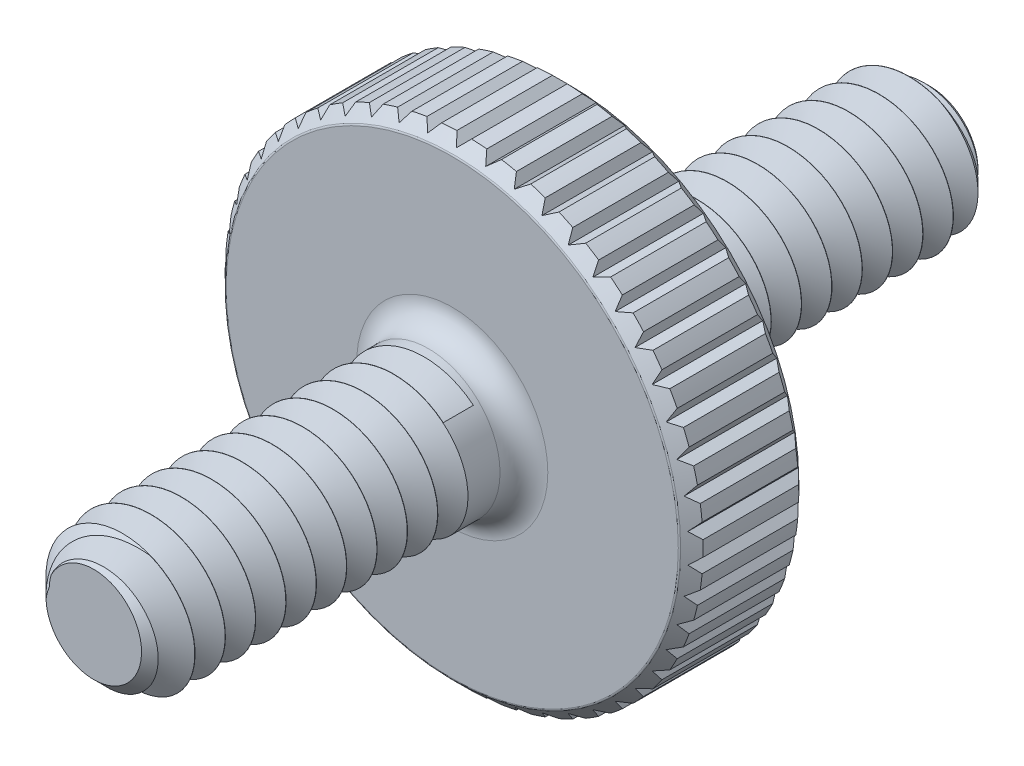
from build123d import *

# Parameters (mm, degrees)
SKETCH_1_R          = 10
EXTRUDE_1_DEPTH     = 5
SKETCH_2_R          = 3
EXTRUDE_2_DEPTH     = 15
EXTRUDE_START       = 15
SKETCH_3_R          = 3
EXTRUDE_3_DEPTH     = 15
CHAMFER_1_SIZE      = 1
CHAMFER_2_SIZE      = 0.5
FILLET_3_R          = 1
SWEEP_1_PITCH       = 1.27
SWEEP_3_PITCH       = 1.27
CUT_EXTRUDE_1_DEPTH = 25.494897509
FILLET_1_R          = 0.1


with BuildPart() as part:
    # Эскиз1 → Бобышка-Вытянуть1 (new body)
    with BuildSketch(Plane.XY):
        Circle(SKETCH_1_R)
    extrude(amount=EXTRUDE_1_DEPTH)

    # Эскиз2 → Бобышка-Вытянуть2 (add)
    with BuildSketch(Plane.XY.offset(5)):
        Circle(SKETCH_2_R)
    extrude(amount=EXTRUDE_2_DEPTH)

    # Эскиз3 → Бобышка-Вытянуть3 (add)
    with BuildSketch(Plane(origin=(0, 0, 0), x_dir=(-1, 0, 0), z_dir=(0, 0, -1)).offset(EXTRUDE_START)):
        with Locations(Location((0, 0, 0), (0, 0, 180))):
            Circle(SKETCH_3_R)
    extrude(amount=-EXTRUDE_3_DEPTH)

    # Фаска1
    chamfer_1_edges = [part.edges().sort_by_distance(p)[0] for p in [
        (-3, 0, -15),
        (-3, 0, 20),
    ]]
    chamfer(chamfer_1_edges, length=CHAMFER_1_SIZE)

    # Фаска2
    chamfer_2_edges = [part.edges().sort_by_distance(p)[0] for p in [
        (-10, 0, 0),
        (-10, 0, 5),
    ]]
    chamfer(chamfer_2_edges, length=CHAMFER_2_SIZE)

    # Скругление3
    fillet_3_edges = [part.edges().sort_by_distance(p)[0] for p in [
        (-3, 0, 5),
        (-3, 0, 0),
    ]]
    fillet(fillet_3_edges, radius=FILLET_3_R)

    # Вырез-По траектории1: arcs per turn and ends read off the stored shape
    # Вырез-По траектории1: the profile of Эскиз7 profile screwed along a right-hand helix through 18.25 turns, 8 arcs to a turn; built about Z, then put on its axis
    sweep_1_z = Axis((0, 0, 0), (0, 0, 1))
    sweep_1_corners = [(1.908807991, 0, -0.04438132), (3.0003, 0, -0.674554525), (3.0003, 0, 0.585791885)]
    with BuildLine(mode=Mode.PRIVATE) as sweep_1_profile:
        Line(sweep_1_corners[0], sweep_1_corners[1])
        Line(sweep_1_corners[1], sweep_1_corners[2])
        Line(sweep_1_corners[2], sweep_1_corners[0])
    sweep_1_cap = Face(sweep_1_profile.wire())
    sweep_1_turn_angles = [0, 22.5, 45, 67.5, 90, 112.5, 135, 157.5, 180, 202.5, 225, 247.5, 270, 292.5, 315, 337.5, 360]
    sweep_1_turn_weights = [1, 0.9238795325112867, 1, 0.9238795325112867, 1, 0.9238795325112867, 1, 0.9238795325112867, 1, 0.9238795325112867, 1, 0.9238795325112867, 1, 0.9238795325112867, 1, 0.9238795325112867, 1]
    sweep_1_turn_rails = [Edge.make_bspline([Vector(p[0], p[1], 0).rotate(sweep_1_z, sweep_1_turn_angles[k]) / sweep_1_turn_weights[k] + Vector(0, 0, p[2] + SWEEP_1_PITCH * sweep_1_turn_angles[k] / 360) for k in range(17)], [0, 0, 0, 1, 1, 2, 2, 3, 3, 4, 4, 5, 5, 6, 6, 7, 7, 8, 8, 8], 2, sweep_1_turn_weights) for p in sweep_1_corners]
    sweep_1_turn_sides = [Face.make_surface_from_curves(sweep_1_turn_rails[p[0]], sweep_1_turn_rails[p[1]]) for p in [(0, 1), (1, 2), (2, 0)]]
    sweep_1_last_angles = [6480, 6502.5, 6525, 6547.5, 6570]
    sweep_1_last_weights = [1, 0.9238795325112867, 1, 0.9238795325111805, 1]
    sweep_1_last_rails = [Edge.make_bspline([Vector(p[0], p[1], 0).rotate(sweep_1_z, sweep_1_last_angles[k]) / sweep_1_last_weights[k] + Vector(0, 0, p[2] + SWEEP_1_PITCH * sweep_1_last_angles[k] / 360) for k in range(5)], [0, 0, 0, 1, 1, 2, 2, 2], 2, sweep_1_last_weights) for p in sweep_1_corners]
    sweep_1_last_sides = [Face.make_surface_from_curves(sweep_1_last_rails[p[0]], sweep_1_last_rails[p[1]]) for p in [(0, 1), (1, 2), (2, 0)]]
    sweep_1 = Plane(origin=(0, 0, 30), x_dir=(-0.7071067811865512, 0.7071067811865438, 0), z_dir=(0, 0, -1)) * Solid(Shell([*[p.moved(Location((0, 0, SWEEP_1_PITCH * i))) for i in range(18) for p in sweep_1_turn_sides], *sweep_1_last_sides, sweep_1_cap, sweep_1_cap.rotate(sweep_1_z, 6570).moved(Location((0, 0, SWEEP_1_PITCH * 6570 / 360)))]))
    add(sweep_1, mode=Mode.SUBTRACT)

    # Вырез-По траектории3: arcs per turn and ends read off the stored shape
    # Вырез-По траектории3: the profile of Эскиз13 profile screwed along a right-hand helix through 12 turns, 8 arcs to a turn; built about Z, then put on its axis
    sweep_3_z = Axis((0, 0, 0), (0, 0, 1))
    sweep_3_corners = [(1.908807991, 0, 0.255243081), (3.0003, 0, -0.374930124), (3.0003, 0, 0.885416286)]
    with BuildLine(mode=Mode.PRIVATE) as sweep_3_profile:
        Line(sweep_3_corners[0], sweep_3_corners[1])
        Line(sweep_3_corners[1], sweep_3_corners[2])
        Line(sweep_3_corners[2], sweep_3_corners[0])
    sweep_3_cap = Face(sweep_3_profile.wire())
    sweep_3_turn_angles = [0, 22.5, 45, 67.5, 90, 112.5, 135, 157.5, 180, 202.5, 225, 247.5, 270, 292.5, 315, 337.5, 360]
    sweep_3_turn_weights = [1, 0.9238795325112867, 1, 0.9238795325112867, 1, 0.9238795325112867, 1, 0.9238795325112867, 1, 0.9238795325112867, 1, 0.9238795325112867, 1, 0.9238795325112867, 1, 0.9238795325112867, 1]
    sweep_3_turn_rails = [Edge.make_bspline([Vector(p[0], p[1], 0).rotate(sweep_3_z, sweep_3_turn_angles[k]) / sweep_3_turn_weights[k] + Vector(0, 0, p[2] + SWEEP_3_PITCH * sweep_3_turn_angles[k] / 360) for k in range(17)], [0, 0, 0, 1, 1, 2, 2, 3, 3, 4, 4, 5, 5, 6, 6, 7, 7, 8, 8, 8], 2, sweep_3_turn_weights) for p in sweep_3_corners]
    sweep_3_turn_sides = [Face.make_surface_from_curves(sweep_3_turn_rails[p[0]], sweep_3_turn_rails[p[1]]) for p in [(0, 1), (1, 2), (2, 0)]]
    sweep_3 = Plane(origin=(0, 0, -17.5), x_dir=(0.7071067811865512, 0.7071067811865438, 0), z_dir=(0, 0, 1)) * Solid(Shell([*[p.moved(Location((0, 0, SWEEP_3_PITCH * i))) for i in range(12) for p in sweep_3_turn_sides], sweep_3_cap, sweep_3_cap.rotate(sweep_3_z, 4320).moved(Location((0, 0, SWEEP_3_PITCH * 4320 / 360)))]))
    add(sweep_3, mode=Mode.SUBTRACT)

    # Эскиз10 → Вырез-Вытянуть1 (cut, through all)
    with BuildSketch(Plane.XY.offset(5)):
        Polygon((-0.313605218, 10), (0, 9.686394782), (0.313605218, 10), align=None)
        Polygon((1.21402718, 9.610014666), (1.564464683, 9.881841857), (0.942199989, 9.960452169), align=None)
        Polygon((2.408908425, 9.382078878), (2.790651605, 9.607841165), (2.183146138, 9.763822058), align=None)
        Polygon((3.565799746, 9.006182101), (3.972828284, 9.182319078), (3.389662769, 9.413210639), align=None)
        Polygon((4.666456275, 8.488252453), (5.092351088, 8.611986334), (4.542722394, 8.914147266), align=None)
        Polygon((5.693520001, 7.836457993), (6.131564474, 7.905837422), (5.624140572, 8.274502466), align=None)
        Polygon((6.630793515, 7.061077909), (7.074079425, 7.07500873), (6.616862694, 7.504363819), align=None)
        Polygon((7.463495454, 6.174340408), (7.905031917, 6.132602924), (7.505232939, 6.615876871), align=None)
        Polygon((8.178493612, 5.190229871), (8.611317334, 5.093482307), (8.275241176, 5.623053593), align=None)
        Polygon((8.76451204, 4.124266308), (9.181797132, 3.974034431), (8.914743917, 4.541551401), align=None)
        Polygon((9.212308877, 2.993260602), (9.607474505, 2.791913658), (9.413655821, 3.38842623), align=None)
        Polygon((9.5148221, 1.815049388), (9.881636265, 1.565762739), (9.764108749, 2.181863553), align=None)
        Polygon((9.667280895, 0.608213761), (9.999958719, 0.314918806), (9.96057585, 0.940891585), align=None)
        Polygon((9.667280895, -0.608213761), (9.96057585, -0.940891585), (9.999958719, -0.314918806), align=None)
        Polygon((9.5148221, -1.815049388), (9.764108749, -2.181863553), (9.881636265, -1.565762739), align=None)
        Polygon((9.212308877, -2.993260602), (9.413655821, -3.38842623), (9.607474505, -2.791913658), align=None)
        Polygon((8.76451204, -4.124266308), (8.914743917, -4.541551401), (9.181797132, -3.974034431), align=None)
        Polygon((8.178493612, -5.190229871), (8.275241176, -5.623053593), (8.611317334, -5.093482307), align=None)
        Polygon((7.463495454, -6.174340408), (7.505232939, -6.615876871), (7.905031917, -6.132602924), align=None)
        Polygon((6.630793515, -7.061077909), (6.616862694, -7.504363819), (7.074079425, -7.07500873), align=None)
        Polygon((5.693520001, -7.836457993), (5.624140572, -8.274502466), (6.131564474, -7.905837422), align=None)
        Polygon((4.666456275, -8.488252453), (4.542722394, -8.914147266), (5.092351088, -8.611986334), align=None)
        Polygon((3.565799746, -9.006182101), (3.389662769, -9.413210639), (3.972828284, -9.182319078), align=None)
        Polygon((2.408908425, -9.382078878), (2.183146138, -9.763822058), (2.790651605, -9.607841165), align=None)
        Polygon((1.21402718, -9.610014666), (0.942199989, -9.960452169), (1.564464683, -9.881841857), align=None)
        Polygon((0, -9.686394782), (-0.313605218, -10), (0.313605218, -10), align=None)
        Polygon((-1.21402718, -9.610014666), (-1.564464683, -9.881841857), (-0.942199989, -9.960452169), align=None)
        Polygon((-2.408908425, -9.382078878), (-2.790651605, -9.607841165), (-2.183146138, -9.763822058), align=None)
        Polygon((-3.565799746, -9.006182101), (-3.972828284, -9.182319078), (-3.389662769, -9.413210639), align=None)
        Polygon((-4.666456275, -8.488252453), (-5.092351088, -8.611986334), (-4.542722394, -8.914147266), align=None)
        Polygon((-5.693520001, -7.836457993), (-6.131564474, -7.905837422), (-5.624140572, -8.274502466), align=None)
        Polygon((-6.630793515, -7.061077909), (-7.074079425, -7.07500873), (-6.616862694, -7.504363819), align=None)
        Polygon((-7.463495454, -6.174340408), (-7.905031917, -6.132602924), (-7.505232939, -6.615876871), align=None)
        Polygon((-8.178493612, -5.190229871), (-8.611317334, -5.093482307), (-8.275241176, -5.623053593), align=None)
        Polygon((-8.76451204, -4.124266308), (-9.181797132, -3.974034431), (-8.914743917, -4.541551401), align=None)
        Polygon((-9.212308877, -2.993260602), (-9.607474505, -2.791913658), (-9.413655821, -3.38842623), align=None)
        Polygon((-9.5148221, -1.815049388), (-9.881636265, -1.565762739), (-9.764108749, -2.181863553), align=None)
        Polygon((-9.667280895, -0.608213761), (-9.999958719, -0.314918806), (-9.96057585, -0.940891585), align=None)
        Polygon((-9.667280895, 0.608213761), (-9.96057585, 0.940891585), (-9.999958719, 0.314918806), align=None)
        Polygon((-9.5148221, 1.815049388), (-9.764108749, 2.181863553), (-9.881636265, 1.565762739), align=None)
        Polygon((-9.212308877, 2.993260602), (-9.413655821, 3.38842623), (-9.607474505, 2.791913658), align=None)
        Polygon((-8.76451204, 4.124266308), (-8.914743917, 4.541551401), (-9.181797132, 3.974034431), align=None)
        Polygon((-8.178493612, 5.190229871), (-8.275241176, 5.623053593), (-8.611317334, 5.093482307), align=None)
        Polygon((-7.463495454, 6.174340408), (-7.505232939, 6.615876871), (-7.905031917, 6.132602924), align=None)
        Polygon((-6.630793515, 7.061077909), (-6.616862694, 7.504363819), (-7.074079425, 7.07500873), align=None)
        Polygon((-5.693520001, 7.836457993), (-5.624140572, 8.274502466), (-6.131564474, 7.905837422), align=None)
        Polygon((-4.666456275, 8.488252453), (-4.542722394, 8.914147266), (-5.092351088, 8.611986334), align=None)
        Polygon((-3.565799746, 9.006182101), (-3.389662769, 9.413210639), (-3.972828284, 9.182319078), align=None)
        Polygon((-2.408908425, 9.382078878), (-2.183146138, 9.763822058), (-2.790651605, 9.607841165), align=None)
        Polygon((-1.21402718, 9.610014666), (-0.942199989, 9.960452169), (-1.564464683, 9.881841857), align=None)
    extrude(amount=-CUT_EXTRUDE_1_DEPTH, mode=Mode.SUBTRACT)

    # Скругление1
    fillet_1_edges = [part.edges().sort_by_distance(p)[0] for p in [
        (-9.5, 0, 5),
        (-9.5, 0, 0),
    ]]
    fillet(fillet_1_edges, radius=FILLET_1_R)


solid = part.part
